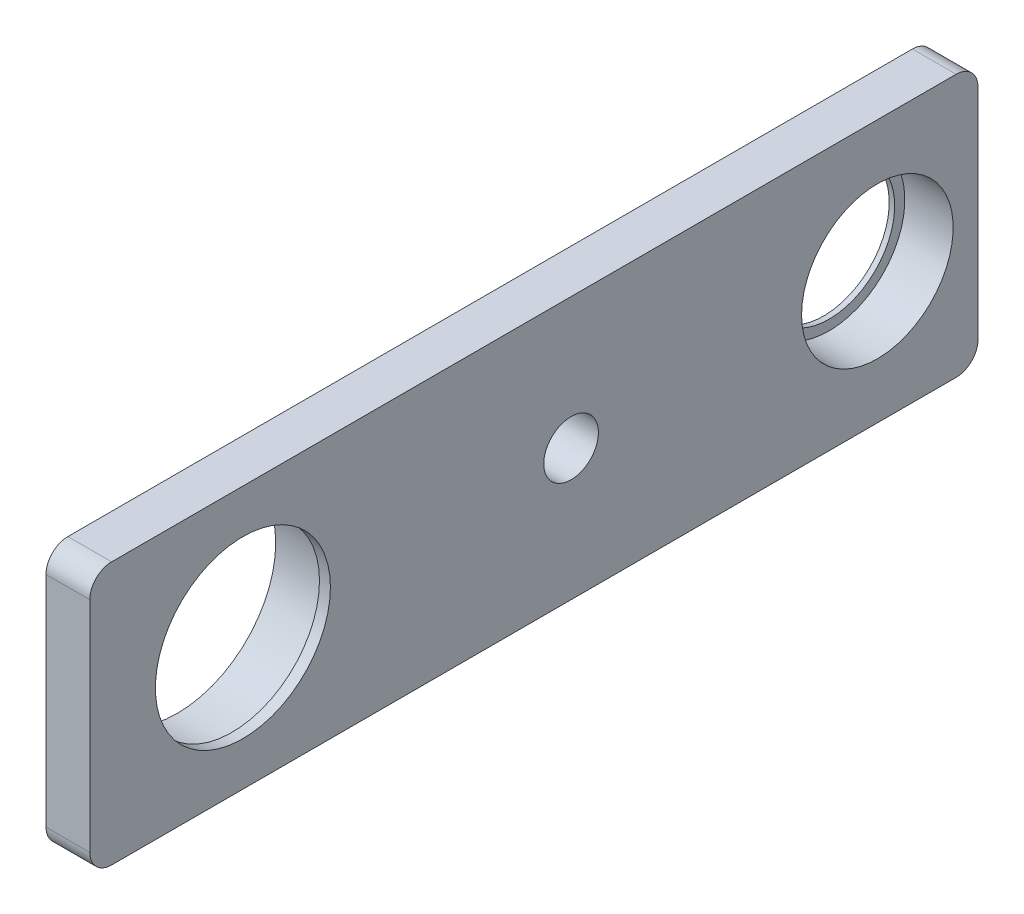
from build123d import *

# Parameters (mm, degrees)
SKETCH1_W            = 123.825
SKETCH1_H            = 38.1
SKETCH1_R            = 14.2875
SKETCH1_R_2          = 3.96875
SKETCH1_R_3          = 4.7625
BOSS_EXTRUDE1_DEPTH  = 6.35
BOSS_EXTRUDE3_START  = -1.5875
SKETCH3_R            = 14.2875
SKETCH3_R_2          = 12.7
BOSS_EXTRUDE3_DEPTH  = 1.5875
BOSS_EXTRUDE5_START  = 3.175
SKETCH5_R            = 15.875
SKETCH5_R_2          = 14.2875
BOSS_EXTRUDE5_DEPTH  = 3.175
SKETCH17_W           = 6.35
SKETCH17_H           = 38.1
BOSS_EXTRUDE8_DEPTH  = 5.08
CUT_EXTRUDE3_REACH   = 136.568
SKETCH16_R           = 11
BOSS_EXTRUDE9_START  = 0.6604
SKETCH18_R           = 12.7
SKETCH18_R_2         = 11
BOSS_EXTRUDE9_DEPTH  = 0.6604
FILLET2_R            = 3.175
BOSS_EXTRUDE10_START = 0.79375
SKETCH19_R           = 12.7
SKETCH19_R_2         = 9.525
BOSS_EXTRUDE10_DEPTH = 0.79375


with BuildPart() as part:
    # Sketch1 → Boss-Extrude1 (new body)
    with BuildSketch(Plane(origin=(0, 0, 0), x_dir=(0, 0, -1), z_dir=(1, 0, 0))):
        with Locations((61.9125, 19.05)):
            Rectangle(SKETCH1_W, SKETCH1_H)
        with Locations((22.225, 19.05)):
            Circle(SKETCH1_R, mode=Mode.SUBTRACT)
        with Locations((69.85, 19.05)):
            Circle(SKETCH1_R_2, mode=Mode.SUBTRACT)
        with Locations((114.3, 19.05)):
            Circle(SKETCH1_R_3, mode=Mode.SUBTRACT)
    extrude(amount=BOSS_EXTRUDE1_DEPTH)

    # Sketch3 → Boss-Extrude3 (add)
    with BuildSketch(Plane(origin=(6.35, 0, 0), x_dir=(0, 0, -1), z_dir=(1, 0, 0)).offset(BOSS_EXTRUDE3_START)):
        with Locations((22.225, 19.05)):
            Circle(SKETCH3_R)
        with Locations((22.225, 19.05)):
            Circle(SKETCH3_R_2, mode=Mode.SUBTRACT)
    extrude(amount=BOSS_EXTRUDE3_DEPTH)

    # Sketch5 → Boss-Extrude5 (add)
    with BuildSketch(Plane.ZY.offset(BOSS_EXTRUDE5_START)):
        with Locations((-22.225, 19.05)):
            Circle(SKETCH5_R)
        with Locations((-22.225, 19.05)):
            Circle(SKETCH5_R_2, mode=Mode.SUBTRACT)
    extrude(amount=-BOSS_EXTRUDE5_DEPTH)

    # Sketch17 → Boss-Extrude8 (add)
    with BuildSketch(Plane(origin=(0, 0, -123.825), x_dir=(-1, 0, 0), z_dir=(0, 0, -1))):
        with Locations((-3.175, 19.05)):
            Rectangle(SKETCH17_W, SKETCH17_H)
    extrude(amount=BOSS_EXTRUDE8_DEPTH)

    # Sketch16 → Cut-Extrude3 (cut, up to next)
    with BuildSketch(Plane.ZY, mode=Mode.PRIVATE) as cut_extrude3_sk1:
        with Locations((-114.3, 19.05)):
            Circle(SKETCH16_R)
    cut_extrude3_tool1 = extrude(cut_extrude3_sk1.sketch, amount=-CUT_EXTRUDE3_REACH, mode=Mode.PRIVATE) & part.part
    add(cut_extrude3_tool1.solids().sort_by_distance((0, 19.05, -114.3))[0], mode=Mode.SUBTRACT)

    # Sketch18 → Boss-Extrude9 (add)
    with BuildSketch(Plane.ZY.offset(BOSS_EXTRUDE9_START)):
        with Locations((-114.3, 19.05)):
            Circle(SKETCH18_R)
        with Locations((-114.3, 19.05)):
            Circle(SKETCH18_R_2, mode=Mode.SUBTRACT)
    extrude(amount=-BOSS_EXTRUDE9_DEPTH)

    # Fillet2
    fillet2_edges = [part.edges().sort_by_distance(p)[0] for p in [
        (3.175, 0, -128.905),
        (3.175, 38.1, -128.905),
        (3.175, 0, 0),
        (3.175, 38.1, 0),
    ]]
    fillet(fillet2_edges, radius=FILLET2_R)

    # Sketch19 → Boss-Extrude10 (add)
    with BuildSketch(Plane.ZY.offset(0.6604).offset(BOSS_EXTRUDE10_START)):
        with Locations((-114.3, 19.05)):
            Circle(SKETCH19_R)
        with Locations((-114.3, 19.05)):
            Circle(SKETCH19_R_2, mode=Mode.SUBTRACT)
    extrude(amount=-BOSS_EXTRUDE10_DEPTH)


solid = part.part
